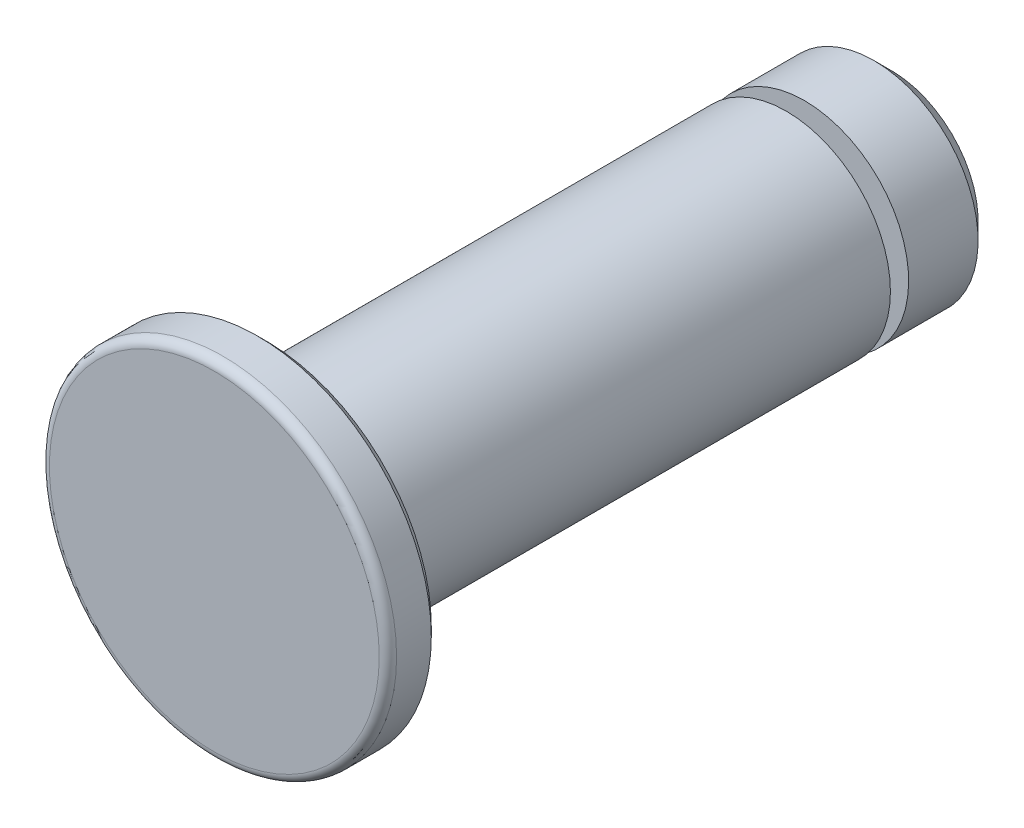
from build123d import *

# Parameters (mm, degrees)
SKETCH1_R           = 10
BOSS_EXTRUDE1_DEPTH = 3
FILLET1_R           = 0.5
SKETCH2_R           = 6
BOSS_EXTRUDE2_DEPTH = 31
CHAMFER1_SIZE       = 0.5
SKETCH3_R           = 6
BOSS_EXTRUDE3_DEPTH = 5
SKETCH4_W           = 1.05
SKETCH4_H           = 2
CHAMFER2_SIZE       = 1


with BuildPart() as part:
    # Sketch1 → Boss-Extrude1 (new body)
    with BuildSketch(Plane.XY):
        Circle(SKETCH1_R)
    extrude(amount=BOSS_EXTRUDE1_DEPTH)

    # Fillet1
    fillet1_edges = [part.edges().sort_by_distance(p)[0] for p in [
        (-10, 0, 3),
    ]]
    fillet(fillet1_edges, radius=FILLET1_R)

    # Sketch2 → Boss-Extrude2 (add)
    with BuildSketch(Plane(origin=(0, 0, 0), x_dir=(-1, 0, 0), z_dir=(0, 0, -1))):
        Circle(SKETCH2_R)
    extrude(amount=BOSS_EXTRUDE2_DEPTH)

    # Chamfer1
    chamfer1_edges = [part.edges().sort_by_distance(p)[0] for p in [
        (-10, 0, 0),
        (6, 0, 0),
    ]]
    chamfer(chamfer1_edges, length=CHAMFER1_SIZE)

    # Sketch3 → Boss-Extrude3 (add)
    with BuildSketch(Plane(origin=(0, 0, -31), x_dir=(-1, 0, 0), z_dir=(0, 0, -1))):
        Circle(SKETCH3_R)
    extrude(amount=BOSS_EXTRUDE3_DEPTH)

    # Sketch4 → Cut-Revolve1 (revolve, cut)
    with BuildSketch(Plane(origin=(0, 0, 0), x_dir=(0, 0, -1), z_dir=(1, 0, 0))):
        with Locations((30.475, 5)):
            Rectangle(SKETCH4_W, SKETCH4_H)
    revolve(axis=Axis((0, 0, -36), (0, 0, 1)), mode=Mode.SUBTRACT)

    # Chamfer2
    chamfer2_edges = [part.edges().sort_by_distance(p)[0] for p in [
        (6, 0, -36),
    ]]
    chamfer(chamfer2_edges, length=CHAMFER2_SIZE)


solid = part.part
